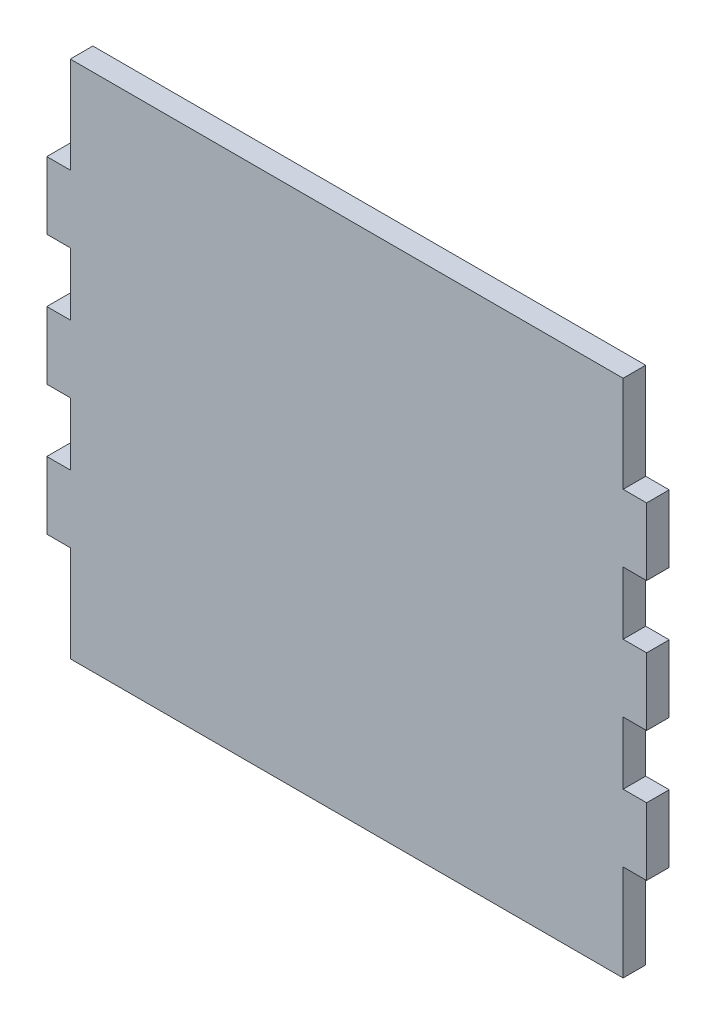
from build123d import *

# Parameters (mm, degrees)
BOSS_EXTRUDE1_DEPTH = 3.175


with BuildPart() as part:
    # Sketch1 → Boss-Extrude1 (new, symmetric)
    with BuildSketch(Plane.XY):
        Polygon((77.724, 73.025), (-77.724, 73.025), (-77.724, 45.974), (-84.328, 45.974), (-84.328, 27.051), (-77.724, 27.051), (-77.724, 9.4615), (-84.328, 9.4615), (-84.328, -9.4615), (-77.724, -9.4615), (-77.724, -27.051), (-84.328, -27.051), (-84.328, -45.974), (-77.724, -45.974), (-77.724, -73.025), (77.724, -73.025), (77.724, -45.974), (84.328, -45.974), (84.328, -27.051), (77.724, -27.051), (77.724, -9.4615), (84.328, -9.4615), (84.328, 9.4615), (77.724, 9.4615), (77.724, 27.051), (84.328, 27.051), (84.328, 45.974), (77.724, 45.974), align=None)
    extrude(amount=BOSS_EXTRUDE1_DEPTH, both=True)


solid = part.part
